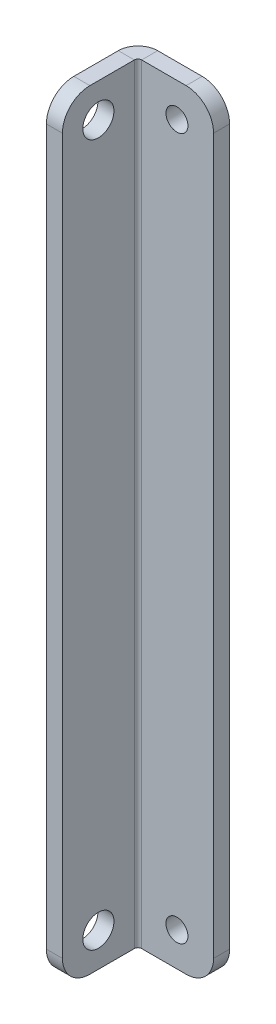
from build123d import *

# Parameters (mm, degrees)
SKETCH1_W                    = 10
SKETCH1_H                    = 84
BASE_FLANGE1_DEPTH           = 1.75
EDGE_FLANGE1_STRIP_W         = 7.8
EDGE_FLANGE1_STRIP_H         = 1.75
EDGE_FLANGE1_STRIP_CUT_DEPTH = 84
EDGE_FLANGE1_DEPTH           = 84
SSD_MOUNTING_HOLES_D         = 2.4
SPINE_MOUNTING_HOLES_D       = 3.4
FILLET1_R                    = 3


# Sheet-metal steps are written as plain solids
with BuildPart() as part:
    # Sketch1 → Base-Flange1 (new body)
    with BuildSketch(Plane.XY):
        with Locations((5, 42)):
            Rectangle(SKETCH1_W, SKETCH1_H)
    extrude(amount=-BASE_FLANGE1_DEPTH)

    # Edge-Flange1 strip (across the edge) → Edge-Flange1 strip cut (cut)
    with BuildSketch(Plane.XZ.offset(-84)):
        with Locations((-1.75, -0.875)):
            Rectangle(EDGE_FLANGE1_STRIP_W, EDGE_FLANGE1_STRIP_H)
    extrude(amount=EDGE_FLANGE1_STRIP_CUT_DEPTH, mode=Mode.SUBTRACT)

    # Edge-Flange1 section (across the edge) → Edge-Flange1 (add)
    with BuildSketch(Plane.XZ.offset(-84)):
        with BuildLine():
            Line((0, 0.4), (0, 8.25))
            Line((0, 8.25), (1.75, 8.25))
            Line((1.75, 8.25), (1.75, 0.4))
            ThreePointArc((1.75, 0.4), (1.867157288, 0.117157288), (2.15, 0))
            Line((2.15, 0), (2.15, -1.75))
            ThreePointArc((2.15, -1.75), (0.62972042, -1.12027958), (0, 0.4))
        make_face()
    extrude(amount=EDGE_FLANGE1_DEPTH)

    # ssd-mounting-holes (through all)
    with Locations(Plane(origin=(6, 80.3, -1.75), x_dir=(-1, 0, 0), z_dir=(0, 0, -1))):
        with Locations((0, 0), (0, -76.6)):
            Hole(SSD_MOUNTING_HOLES_D / 2)

    # spine-mounting-holes (through all)
    with Locations(Plane(origin=(1.75, 0, 0), x_dir=(0, 0, -1), z_dir=(1, 0, 0))):
        with Locations((-4.325, 80.3), (-4.325, 3.7)):
            Hole(SPINE_MOUNTING_HOLES_D / 2)

    # Fillet1
    fillet1_edges = [part.edges().sort_by_distance(p)[0] for p in [
        (0.875, 84, 8.25),
        (0.875, 0, 8.25),
        (10, 84, -0.875),
        (10, 0, -0.875),
    ]]
    fillet(fillet1_edges, radius=FILLET1_R)


solid = part.part
